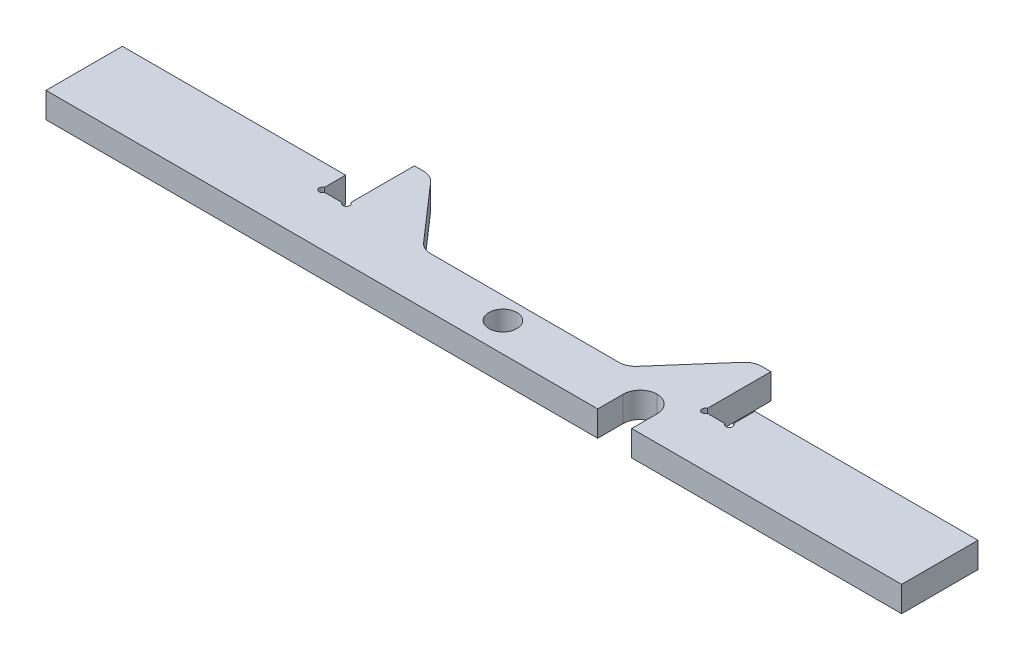
from build123d import *

# Parameters (mm, degrees)
SKETCH1_R           = 8.25
BOSS_EXTRUDE1_DEPTH = 15
FILLET1_R           = 10
BOSS_EXTRUDE2_DEPTH = 15
SKETCH3_W           = 20
SKETCH3_H           = 25
CUT_EXTRUDE1_DEPTH  = 262.971372482
FILLET2_R           = 10
SKETCH4_R           = 2
CUT_EXTRUDE2_DEPTH  = 262.971372482


with BuildPart() as part:
    # Sketch1 → Boss-Extrude1 (new body)
    with BuildSketch(Plane(origin=(0, 0, 0), x_dir=(1, 0, 0), z_dir=(0, 1, 0))):
        Polygon((-105, 0), (105, 0), (105, 70), (95, 70), (60, 30), (-60, 30), (-95, 70), (-105, 70), align=None)
        with Locations(Location((0, 17.15, 0), (0, 0, 270))):
            Circle(SKETCH1_R, mode=Mode.SUBTRACT)
    extrude(amount=BOSS_EXTRUDE1_DEPTH)

    # Fillet1
    fillet1_edges = [part.edges().sort_by_distance(p)[0] for p in [
        (-95, 7.5, -70),
        (-60, 7.5, -30),
        (60, 7.5, -30),
        (95, 7.5, -70),
    ]]
    fillet(fillet1_edges, radius=FILLET1_R)

    # Sketch2 → Boss-Extrude2 (add)
    with BuildSketch(Plane(origin=(0, 15, 0), x_dir=(1, 0, 0), z_dir=(0, 1, 0))):
        Polygon((105, 0), (252, 0), (252, 45), (120.5, 45), (120.5, 30), (105, 30), align=None)
    boss_extrude2 = extrude(amount=-BOSS_EXTRUDE2_DEPTH)

    # Mirror1: Boss-Extrude2 across plane
    add(boss_extrude2.mirror(Plane(origin=(0, 0, 0), x_dir=(0, 0, 1), z_dir=(1, 0, 0))))

    # Sketch3 → Cut-Extrude1 (cut, through all)
    with BuildSketch(Plane(origin=(0, 15, 0), x_dir=(1, 0, 0), z_dir=(0, 1, 0))):
        with Locations((83, 12.5)):
            Rectangle(SKETCH3_W, SKETCH3_H)
    extrude(amount=-CUT_EXTRUDE1_DEPTH, mode=Mode.SUBTRACT)

    # Fillet2
    fillet2_edges = [part.edges().sort_by_distance(p)[0] for p in [
        (73, 7.5, -25),
        (93, 7.5, -25),
    ]]
    fillet(fillet2_edges, radius=FILLET2_R - 0.0001)  # a hair under: the kernel refuses the full size

    # Sketch4 → Cut-Extrude2 (cut, through all)
    with BuildSketch(Plane(origin=(0, 15, 0), x_dir=(1, 0, 0), z_dir=(0, 1, 0))):
        with Locations((-119.792893219, 30.707106781)):
            Circle(SKETCH4_R)
        with Locations((-105.707106781, 30.707106781)):
            Circle(SKETCH4_R)
        with Locations((105.707106781, 30.707106781)):
            Circle(SKETCH4_R)
        with Locations((119.792893219, 30.707106781)):
            Circle(SKETCH4_R)
    extrude(amount=-CUT_EXTRUDE2_DEPTH, mode=Mode.SUBTRACT)


solid = part.part
